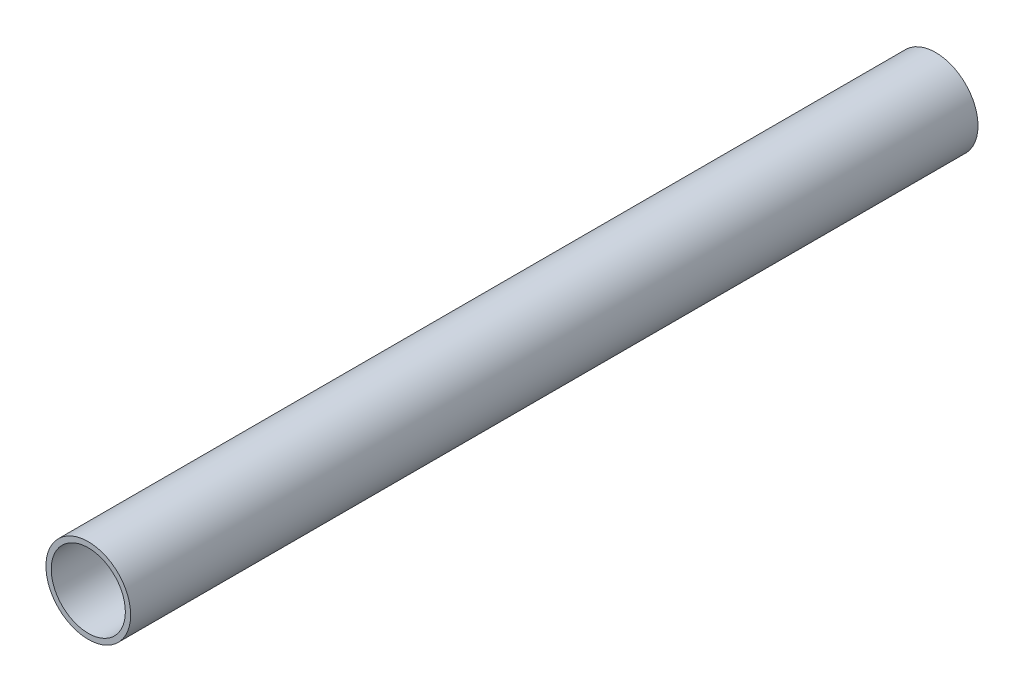
from build123d import *

# Parameters (mm, degrees)
SKETCH2_R           = 12.7
SKETCH2_R_2         = 11.1125
BOSS_EXTRUDE1_DEPTH = 127
SKETCH3_R           = 2.4892
CUT_EXTRUDE1_DEPTH  = 129.263712717


with BuildPart() as part:
    # Sketch2 → Boss-Extrude1 (new, symmetric)
    with BuildSketch(Plane.XY):
        Circle(SKETCH2_R)
        Circle(SKETCH2_R_2, mode=Mode.SUBTRACT)
    extrude(amount=BOSS_EXTRUDE1_DEPTH, both=True)

    # Sketch3 → Cut-Extrude1 (cut, through all)
    with BuildSketch(Plane(origin=(0, 0, 0), x_dir=(1, 0, 0), z_dir=(0, 1, 0))):
        Circle(SKETCH3_R)
    extrude(amount=-CUT_EXTRUDE1_DEPTH, mode=Mode.SUBTRACT)


solid = part.part
